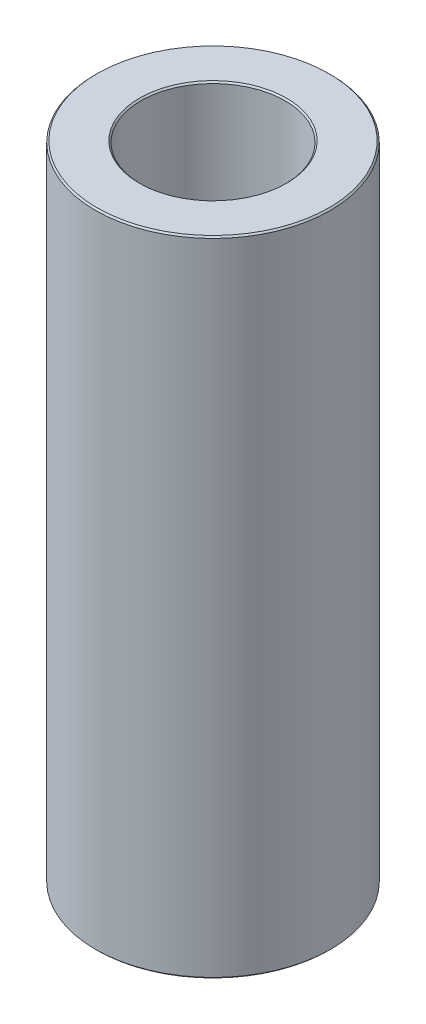
from build123d import *

# Parameters (mm, degrees)
SKETCH1_R           = 32.5
BOSS_EXTRUDE1_DEPTH = 177.724273987
SKETCH2_R           = 19.95064428
CUT_EXTRUDE1_DEPTH  = 184.571287418
CHAMFER1_SIZE       = 0.414427007


with BuildPart() as part:
    # Sketch1 → Boss-Extrude1 (new body)
    with BuildSketch(Plane(origin=(0, 0, 0), x_dir=(1, 0, 0), z_dir=(0, 1, 0))):
        Circle(SKETCH1_R)
    extrude(amount=BOSS_EXTRUDE1_DEPTH)

    # Sketch2 → Cut-Extrude1 (cut, through all)
    with BuildSketch(Plane(origin=(0, 0, 0), x_dir=(1, 0, 0), z_dir=(0, 1, 0))):
        Circle(SKETCH2_R)
    extrude(amount=CUT_EXTRUDE1_DEPTH, mode=Mode.SUBTRACT)

    # Chamfer1
    chamfer1_edges = [part.edges().sort_by_distance(p)[0] for p in [
        (-19.95064428, 177.724273987, 0),
        (-19.95064428, 0, 0),
        (-32.5, 0, 0),
        (-32.5, 177.724273987, 0),
    ]]
    chamfer(chamfer1_edges, length=CHAMFER1_SIZE)


solid = part.part
